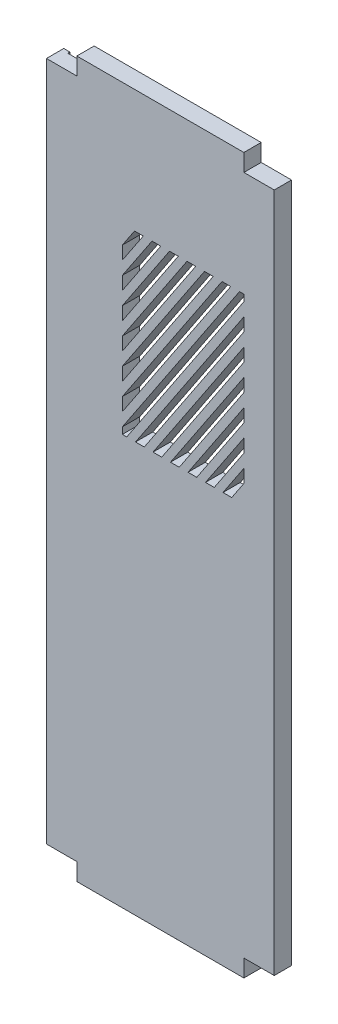
from build123d import *

# Parameters (mm, degrees)
SKETCH1_W           = 75
SKETCH1_H           = 235.4
BOSS_EXTRUDE1_DEPTH = 5.7
SKETCH2_W           = 10
SKETCH2_H           = 5.7
CUT_EXTRUDE1_DEPTH  = 5.7
CUT_EXTRUDE2_DEPTH  = 5.7
SKETCH4_W           = 3
SKETCH4_H           = 224
CUT_EXTRUDE3_DEPTH  = 0.7


with BuildPart() as part:
    # Sketch1 → Boss-Extrude1 (new body)
    with BuildSketch(Plane.XY):
        with Locations((37.5, 117.7)):
            Rectangle(SKETCH1_W, SKETCH1_H)
    extrude(amount=BOSS_EXTRUDE1_DEPTH)

    # Sketch2 → Cut-Extrude1 (cut)
    with BuildSketch(Plane(origin=(0, 0, 0), x_dir=(-1, 0, 0), z_dir=(0, 0, -1))):
        with Locations((-70, 2.85)):
            Rectangle(SKETCH2_W, SKETCH2_H)
        with Locations((-5, 2.85)):
            Rectangle(SKETCH2_W, SKETCH2_H)
        with Locations((-5, 232.55)):
            Rectangle(SKETCH2_W, SKETCH2_H)
        with Locations((-70, 232.55)):
            Rectangle(SKETCH2_W, SKETCH2_H)
    extrude(amount=-CUT_EXTRUDE1_DEPTH, mode=Mode.SUBTRACT)

    # Sketch3 → Cut-Extrude2 (cut)
    with BuildSketch(Plane.XY.offset(5.7)):
        Polygon((31.87777949, 195), (28.99777949, 195), (25, 189.003330765), (25, 184.683330765), align=None)
        Polygon((37.63777949, 195), (34.75777949, 195), (25, 180.363330765), (25, 176.043330765), align=None)
        Polygon((43.39777949, 195), (40.51777949, 195), (25, 171.723330765), (25, 167.403330765), align=None)
        Polygon((49.15777949, 195), (46.27777949, 195), (25, 163.083330765), (25, 158.763330765), align=None)
        Polygon((54.91777949, 195), (52.03777949, 195), (25, 154.443330765), (25, 150.123330765), align=None)
        Polygon((60.67777949, 195), (57.79777949, 195), (25, 145.803330765), (25, 141.483330765), align=None)
        Polygon((65, 195), (63.55777949, 195), (25, 137.163330765), (25, 135), (26.44222051, 135), (65, 192.836669235), align=None)
        Polygon((65, 184.196669235), (65, 188.516669235), (29.32222051, 135), (32.20222051, 135), align=None)
        Polygon((65, 175.556669235), (65, 179.876669235), (35.08222051, 135), (37.96222051, 135), align=None)
        Polygon((65, 166.916669235), (65, 171.236669235), (40.84222051, 135), (43.72222051, 135), align=None)
        Polygon((65, 158.276669235), (65, 162.596669235), (46.60222051, 135), (49.48222051, 135), align=None)
        Polygon((65, 149.636669235), (65, 153.956669235), (52.36222051, 135), (55.24222051, 135), align=None)
        Polygon((65, 140.996669235), (65, 145.316669235), (58.12222051, 135), (61.00222051, 135), align=None)
    extrude(amount=-CUT_EXTRUDE2_DEPTH, mode=Mode.SUBTRACT)

    # Sketch4 → Cut-Extrude3 (cut)
    with BuildSketch(Plane(origin=(0, 0, 0), x_dir=(-1, 0, 0), z_dir=(0, 0, -1))):
        with Locations((-3.5, 117.7)):
            Rectangle(SKETCH4_W, SKETCH4_H)
    extrude(amount=-CUT_EXTRUDE3_DEPTH, mode=Mode.SUBTRACT)


solid = part.part
